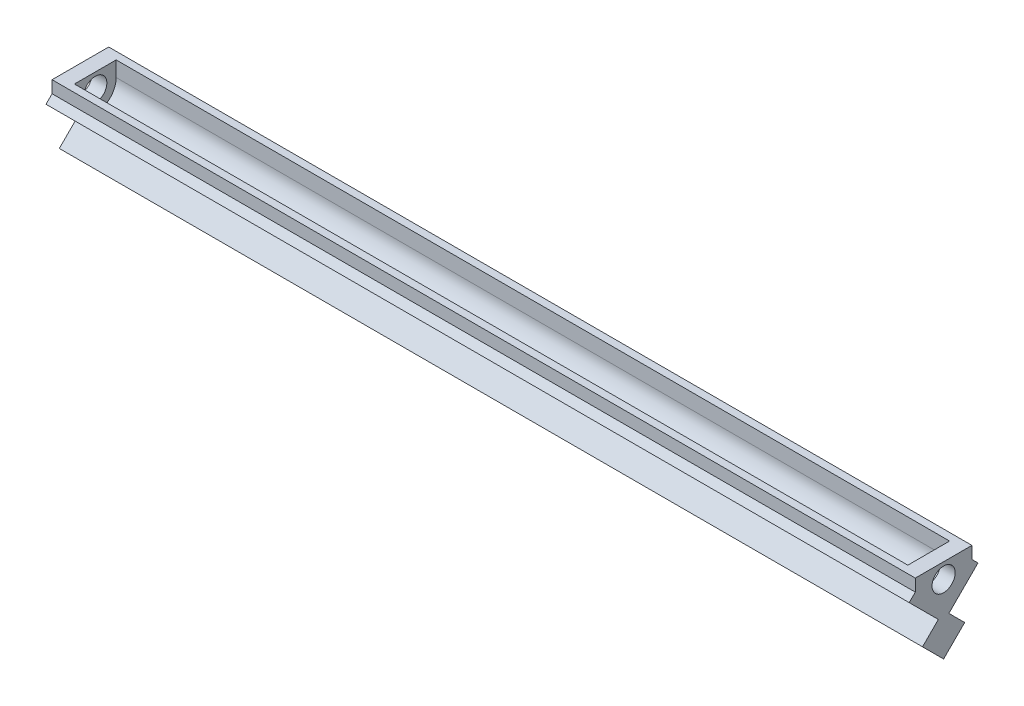
from build123d import *

# Parameters (mm, degrees)
STOCK_PFRD_START               = -138.967906757
STOCK_PFRD_JOINER_BASE_1_DEPTH = 115.804519766
BOSS_EXTRUDE1_DEPTH            = 115.804519766
CUT_EXTRUDE1_START             = -2
SKETCH3_R                      = 1.55
CUT_EXTRUDE1_DEPTH             = 111.804519766
CUT_EXTRUDE2_DEPTH             = 200.295085296
CUT_EXTRUDE2_DEPTH_BACK        = 200.295085296
SKETCH3_2_R                    = 1.55
BOSS_EXTRUDE2_DEPTH            = 2


# Read off the part's stored shape, not the designer's step: Stock-PFRD - Joiner Base-1
with BuildPart() as part:
    # Stock-PFRD - Joiner Base-1 outline → Stock-PFRD - Joiner Base-1 (new body)
    with BuildSketch(Plane.YZ.offset(STOCK_PFRD_START)):
        Polygon((-152.481031246, -3.820121679), (-152.491152925, -3.81), (-152.491152925, 3.81), (-152.481031246, 3.820121679), (-153.274781314, 4.613871747), (-157.18154628, 0.707106781), (-159.302866623, 2.828427125), (-162.131293748, 0), (-159.302866623, -2.828427125), (-157.18154628, -0.707106781), (-153.274781314, -4.613871747), align=None)
    extrude(amount=STOCK_PFRD_JOINER_BASE_1_DEPTH)

    # Sketch2 → Boss-Extrude1 (add)
    with BuildSketch(Plane.ZY.offset(138.967906757)):
        Polygon((3.830243359, -152.491152925), (2.166996747, -150.827906314), (-2.166996747, -150.827906314), (-3.830243359, -152.491152925), (3.81, -152.491152925), align=None)
    extrude(amount=-BOSS_EXTRUDE1_DEPTH)

    # Sketch3 → Cut-Extrude1 (cut)
    with BuildSketch(Plane(origin=(-23.163386991, 0, 0), x_dir=(0, 0, -1), z_dir=(1, 0, 0)).offset(CUT_EXTRUDE1_START)):
        with BuildLine():
            Line((2.8, -150.827906314), (2.8, -152.877906314))
            ThreePointArc((2.8, -152.877906314), (0, -155.677906314), (-2.8, -152.877906314))
            Line((-2.8, -152.877906314), (-2.8, -150.827906314))
            ThreePointArc((-2.8, -150.827906314), (0, -148.027906314), (2.8, -150.827906314))
        make_face()
        with Locations(Location((0, -152.877906314, 0), (0, 0, 90))):
            Circle(SKETCH3_R, mode=Mode.SUBTRACT)
    extrude(amount=-CUT_EXTRUDE1_DEPTH, mode=Mode.SUBTRACT)

    # Sketch3<2> → Cut-Extrude2 (cut, two sides: drawn at the far end of the back side and taken through both)
    with BuildSketch(Plane(origin=(-23.163386991, 0, 0), x_dir=(0, 0, -1), z_dir=(1, 0, 0)).offset(-CUT_EXTRUDE2_DEPTH_BACK)):
        with Locations(Location((0, -152.877906314, 0), (0, 0, 90))):
            Circle(SKETCH3_2_R)
    extrude(amount=CUT_EXTRUDE2_DEPTH + CUT_EXTRUDE2_DEPTH_BACK, mode=Mode.SUBTRACT)

    # Sketch4 → Boss-Extrude2 (add)
    with BuildSketch(Plane(origin=(0, -150.827906314, 0), x_dir=(1, 0, 0), z_dir=(0, 1, 0))):
        Polygon((-138.967906757, 2.166996747), (-136.967906757, 2.166996747), (-136.967906757, 2.8), (-25.163386991, 2.8), (-25.163386991, 2.166996747), (-23.163386991, 2.166996747), (-23.163386991, 3.8), (-138.967906757, 3.8), align=None)
    boss_extrude2 = extrude(amount=-BOSS_EXTRUDE2_DEPTH)

    # Mirror1: Boss-Extrude2 across plane
    add(boss_extrude2.mirror(Plane(origin=(0, 0, 0), x_dir=(1, 0, 0), z_dir=(0, 0, -1))))


solid = part.part
